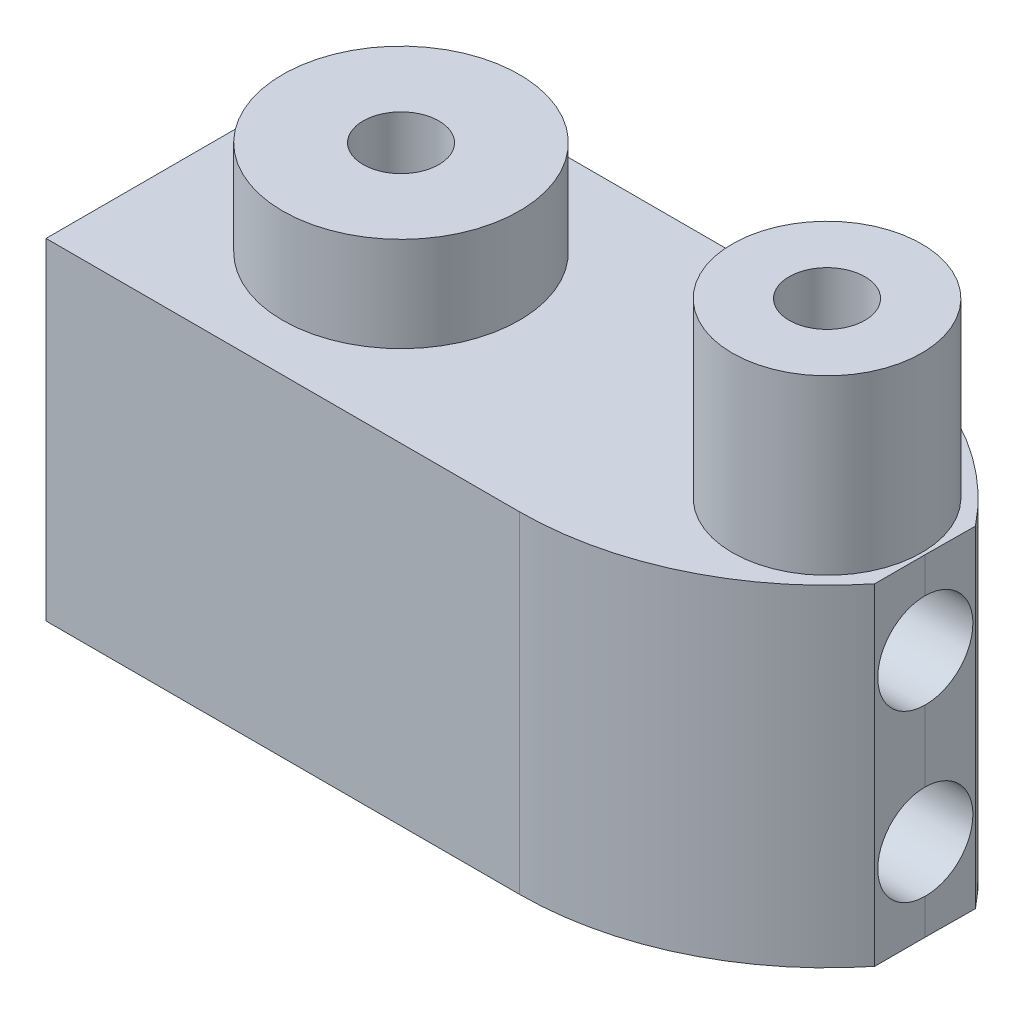
from build123d import *

# Parameters (mm, degrees)
SKETCH_1_W               = 33
SKETCH_1_H               = 14
EXTRUDE_1_DEPTH          = 14
SKETCH_2_W               = 10
SKETCH_2_H               = 12
CUT_EXTRUDE_1_DEPTH      = 25.3
SKETCH_3_R               = 2
CUT_EXTRUDE_2_DEPTH      = 25.5
SKETCH_7_R               = 5
SKETCH_7_R_2             = 1.6
EXTRUDE_4_DEPTH          = 4
FILLET_4_DEPTH           = 14
SKETCH_8_R               = 4
SKETCH_8_R_2             = 1.6
EXTRUDE_5_DEPTH          = 7.3
SKETCH_10_R              = 2.5
EXTRUDE_6_DEPTH          = 4
CUT_EXTRUDE_3_DEPTH      = 26.401771619
CUT_EXTRUDE_3_DEPTH_BACK = 20


with BuildPart() as part:
    # 草图1 → 凸台-拉伸1 (new body)
    with BuildSketch(Plane(origin=(0, 0, 0), x_dir=(1, 0, 0), z_dir=(0, 1, 0))):
        Rectangle(SKETCH_1_W, SKETCH_1_H)
    extrude(amount=EXTRUDE_1_DEPTH)

    # 草图2 → 切除-拉伸1 (cut)
    with BuildSketch(Plane.ZY.offset(16.5)):
        with Locations((0, 7)):
            Rectangle(SKETCH_2_W, SKETCH_2_H)
    extrude(amount=-CUT_EXTRUDE_1_DEPTH, mode=Mode.SUBTRACT)

    # 草图3 → 切除-拉伸2 (cut)
    with BuildSketch(Plane(origin=(16.5, 0, 0), x_dir=(0, 0, -1), z_dir=(1, 0, 0))):
        with Locations((0, 10.5)):
            Circle(SKETCH_3_R)
        with Locations((0, 3.5)):
            Circle(SKETCH_3_R)
    extrude(amount=-CUT_EXTRUDE_2_DEPTH, mode=Mode.SUBTRACT)

    # 草图7 → 凸台-拉伸4 (add)
    with BuildSketch(Plane(origin=(0, 14, 0), x_dir=(1, 0, 0), z_dir=(0, 1, 0))):
        with Locations(Location((-8.5, 0, 0), (0, 0, 270))):
            Circle(SKETCH_7_R)
        with Locations(Location((-8.5, 0, 0), (0, 0, 270))):
            Circle(SKETCH_7_R_2, mode=Mode.SUBTRACT)
    extrude(amount=EXTRUDE_4_DEPTH)

    # 圆角4: read off the stored shape, not the designer's step
    # 圆角4 outline → 圆角4 (cut)
    with BuildSketch(Plane(origin=(0, 0, 0), x_dir=(1, 0, 0), z_dir=(0, 1, 0))):
        with BuildLine():
            ThreePointArc((3.5, 7), (10.245368782, 5.113055385), (15.032562595, 0))
            ThreePointArc((15.032562595, 0), (10.245368782, -5.113055385), (3.5, -7))
            Line((3.5, -7), (16.5, -7))
            Line((16.5, -7), (16.5, 7))
            Line((16.5, 7), (3.5, 7))
        make_face()
    extrude(amount=FILLET_4_DEPTH, mode=Mode.SUBTRACT)

    # 草图8 → 凸台-拉伸5 (add)
    with BuildSketch(Plane(origin=(0, 14, 0), x_dir=(1, 0, 0), z_dir=(0, 1, 0))):
        with Locations(Location((9.5, 0, 0), (0, 0, 270))):
            Circle(SKETCH_8_R)
        with Locations(Location((9.5, 0, 0), (0, 0, 270))):
            Circle(SKETCH_8_R_2, mode=Mode.SUBTRACT)
    extrude(amount=EXTRUDE_5_DEPTH)

    # 草图10 → 凸台-拉伸6 (add)
    with BuildSketch(Plane.XZ):
        with Locations(Location((-8.5, 0, 0), (0, 0, 270))):
            Circle(SKETCH_10_R)
    extrude(amount=EXTRUDE_6_DEPTH)

    # 草图11 → 切除-拉伸3 (cut, two sides: drawn at the far end of the back side and taken through both)
    with BuildSketch(Plane(origin=(0, 14, 0), x_dir=(1, 0, 0), z_dir=(0, 1, 0)).offset(-CUT_EXTRUDE_3_DEPTH_BACK)):
        with BuildLine():
            Line((13.662777944, 2.1066605), (13.644074044, 0))
            Line((13.644074044, 0), (15.032562595, 0))
            ThreePointArc((15.032562595, 0), (14.398690512, 1.086504435), (13.662777944, 2.1066605))
        make_face()
        with BuildLine():
            Line((15.032562595, 0), (13.644074044, 0))
            Line((13.644074044, 0), (13.644074044, -2.130053001))
            ThreePointArc((13.644074044, -2.130053001), (14.39051998, -1.099054484), (15.032562595, 0))
        make_face()
    extrude(amount=CUT_EXTRUDE_3_DEPTH + CUT_EXTRUDE_3_DEPTH_BACK, mode=Mode.SUBTRACT)


solid = part.part
